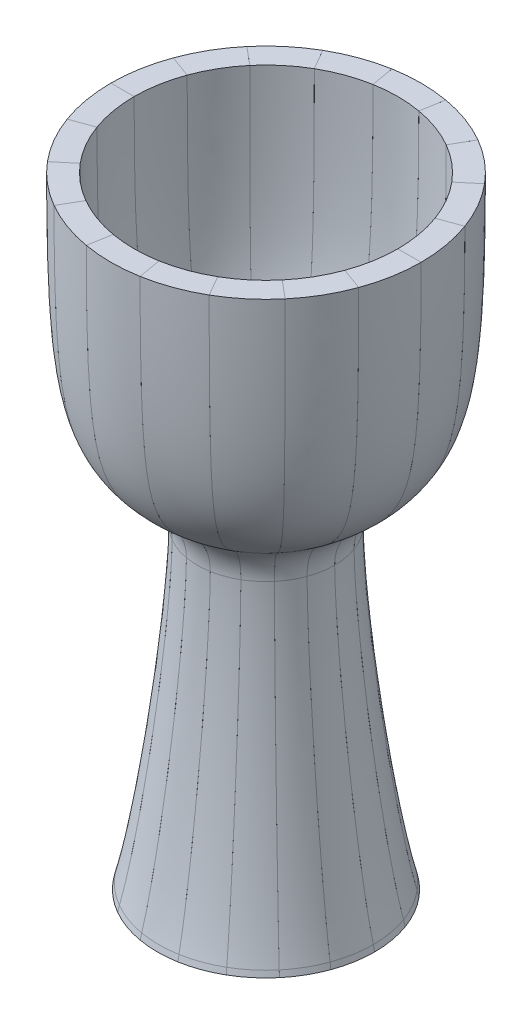
from build123d import *

# Parameters (mm, degrees)
CUT_EXTRUDE1_DEPTH = 539.815367406


with BuildPart() as part:
    # Sketch1 → Revolve1 (revolve)
    with BuildSketch(Plane.XY):
        with BuildLine():
            Line((127, 508), (107.95, 508))
            add(Edge.make_bspline(
                [(107.95, 508), (107.95, 507.131017741), (107.949446963, 505.381110869), (107.946173936, 501.976837003), (107.938101727, 497.830302447), (107.922291258, 493.039099052), (107.893344631, 486.87674674), (107.842939936, 479.578085106), (107.761175351, 471.400758005), (107.659380757, 463.748693579), (107.498356912, 454.181089513), (107.251970387, 443.302373617), (106.889848649, 431.689367596), (106.465265976, 421.293466264), (105.981011125, 411.934295265), (105.258153007, 400.645169357), (104.212780633, 388.458078791), (102.733267495, 376.190788711), (101.023589694, 365.78144058), (99.073173869, 356.858086991), (96.863490884, 349.127430772), (94.35954793, 342.331963127), (91.491303661, 336.216323879), (88.121160027, 330.503508973), (84.690937005, 325.823937156), (81.371595594, 321.964737928), (78.52394539, 318.969359894), (75.235586022, 315.82766683), (72.043783835, 313.046700624), (69.155576231, 310.695263717), (66.804422568, 308.861121282), (64.66839011, 307.262776548), (62.852809749, 305.945045279), (61.887806688, 305.258557567), (61.410131335, 304.92205141)],
                knots=[0, 0, 0, 0, 0.00390625, 0.0078125, 0.015625, 0.0234375, 0.03125, 0.046875, 0.0625, 0.078125, 0.09375, 0.125, 0.15625, 0.1875, 0.21875, 0.25, 0.3125, 0.375, 0.4375, 0.5, 0.5625, 0.625, 0.6875, 0.75, 0.8125, 0.84375, 0.875, 0.90625, 0.9375, 0.953125, 0.96875, 0.984375, 0.9921875, 1, 1, 1, 1], degree=3))
            ThreePointArc((61.410131335, 304.92205141), (43.476609406, 284.291917188), (37.175663253, 257.692824641))
            add(Edge.make_bspline(
                [(37.175663253, 257.692824641), (37.182580195, 256.915255179), (37.201220218, 255.388247765), (37.261387677, 252.109827295), (37.379522428, 247.736527556), (37.594925853, 241.980344027), (37.888329387, 235.715431437), (38.263951688, 228.931474415), (38.879196572, 219.196974275), (39.870675466, 205.753183583), (41.428923772, 187.751232702), (43.348295893, 168.202811343), (45.59896577, 147.567636744), (48.128587222, 126.412427515), (50.865960704, 105.359676538), (53.727811454, 85.025522051), (56.627434482, 65.958502861), (59.483557441, 48.590726254), (61.770159421, 35.774551013), (63.518245829, 26.583214641), (64.784624778, 20.222478245), (66.002977016, 14.391885716), (67.172545185, 9.076582978), (68.103871415, 5.071552722), (68.829596884, 2.087072172), (69.176461514, 0.704104754), (69.355997936, 0)],
                knots=[0, 0, 0, 0, 0.015625, 0.03125, 0.0625, 0.09375, 0.125, 0.15625, 0.1875, 0.25, 0.3125, 0.375, 0.4375, 0.5, 0.5625, 0.625, 0.6875, 0.75, 0.8125, 0.84375, 0.875, 0.90625, 0.9375, 0.96875, 0.984375, 1, 1, 1, 1], degree=3))
            Line((69.355997936, 0), (88.9, 0))
            Line((88.9, 0), (87.815356186, 4.706866579))
            add(Edge.make_bspline(
                [(56.224909569, 257.862279011), (57.416357198, 123.925459958), (87.815356186, 4.706866579)],
                knots=[0, 0, 0, 1, 1, 1], degree=2, weights=[1, 0.513306274, 1]))
            ThreePointArc((56.224909569, 257.862279011), (60.425540338, 275.595007376), (72.381221623, 289.348430191))
            add(Edge.make_bspline(
                [(127, 508), (127, 327.825515296), (72.381221623, 289.348430191)],
                knots=[0, 0, 0, 1, 1, 1], degree=2, weights=[1, 1.878324791, 1]))
        make_face()
    revolve(axis=Axis((0, 0, 0), (0, 1, 0)))

    # Sketch2 → Cut-Extrude1 (cut, through all)
    with BuildSketch(Plane(origin=(0, 508, 0), x_dir=(1, 0, 0), z_dir=(0, 1, 0))):
        Polygon((-18.973149737, 0), (-18.973149567, 0.00254), (-323.773148884, 0.022942306), (-323.773149054, 0.020402306), align=None)
        Polygon((-17.828928801, 6.489199392), (-304.240260975, 110.756110741), (-304.239392085, 110.758497502), (-17.82805991, 6.491586154), align=None)
        Polygon((-14.534275925, 12.195705568), (-248.011507315, 208.132997634), (-248.009874504, 208.134943278), (-14.532643114, 12.197651211), align=None)
        Polygon((-9.486574869, 16.431229662), (-161.868905612, 280.405973297), (-161.866705823, 280.40724315), (-9.484375079, 16.432499515), align=None)
        Polygon((-3.294652876, 18.68490496), (-56.202524962, 318.857850229), (-56.200023521, 318.858291128), (-3.292151435, 18.685345859), align=None)
        Polygon((3.294652876, 18.68490496), (56.24270966, 318.850764583), (56.245211042, 318.850323349), (3.297154259, 18.684463726), align=None)
        Polygon((9.486574869, 16.431229662), (161.904243442, 280.385570992), (161.906443062, 280.384300844), (9.488774488, 16.429959515), align=None)
        Polygon((14.534275925, 12.195705568), (248.037736014, 208.101739488), (248.039368564, 208.099793626), (14.535908475, 12.193759706), align=None)
        Polygon((17.828928801, 6.489199392), (304.254216974, 110.717766948), (304.255085546, 110.715380071), (17.829797372, 6.486812515), align=None)
        Polygon((18.973149737, 0), (323.773149054, -0.020402306), (323.773148884, -0.022942306), (18.973149567, -0.00254), align=None)
        Polygon((17.828928801, -6.489199392), (304.240260975, -110.756110741), (304.239392085, -110.758497502), (17.82805991, -6.491586154), align=None)
        Polygon((14.534275925, -12.195705568), (248.011507315, -208.132997634), (248.009874504, -208.134943278), (14.532643114, -12.197651211), align=None)
        Polygon((9.486574869, -16.431229662), (161.868905612, -280.405973297), (161.866705823, -280.40724315), (9.484375079, -16.432499515), align=None)
        Polygon((3.294652876, -18.68490496), (56.202524962, -318.857850229), (56.200023521, -318.858291128), (3.292151435, -18.685345859), align=None)
        Polygon((-3.294652876, -18.68490496), (-56.24270966, -318.850764583), (-56.245211042, -318.850323349), (-3.297154259, -18.684463726), align=None)
        Polygon((-9.486574869, -16.431229662), (-161.904243442, -280.385570992), (-161.906443062, -280.384300844), (-9.488774488, -16.429959515), align=None)
        Polygon((-14.534275925, -12.195705568), (-248.037736014, -208.101739488), (-248.039368564, -208.099793626), (-14.535908475, -12.193759706), align=None)
        Polygon((-17.828928801, -6.489199392), (-304.254216974, -110.717766948), (-304.255085546, -110.715380071), (-17.829797372, -6.486812515), align=None)
    extrude(amount=-CUT_EXTRUDE1_DEPTH, mode=Mode.SUBTRACT)


solid = part.part
